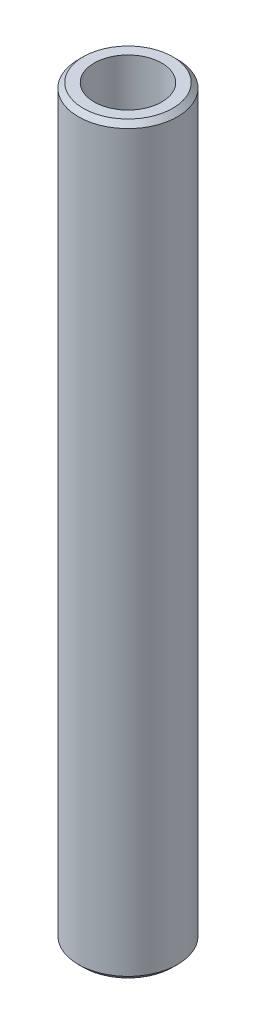
from build123d import *

# Parameters (mm, degrees)
SKETCH1_R           = 40
BOSS_EXTRUDE1_DEPTH = 600
SKETCH2_R           = 27.250790267
CUT_EXTRUDE1_DEPTH  = 603.660766933
CHAMFER1_SIZE       = 3.919962224


with BuildPart() as part:
    # Sketch1 → Boss-Extrude1 (new body)
    with BuildSketch(Plane(origin=(0, 0, 0), x_dir=(1, 0, 0), z_dir=(0, 1, 0))):
        Circle(SKETCH1_R)
    extrude(amount=BOSS_EXTRUDE1_DEPTH)

    # Sketch2 → Cut-Extrude1 (cut, through all)
    with BuildSketch(Plane(origin=(0, 0, 0), x_dir=(1, 0, 0), z_dir=(0, 1, 0))):
        Circle(SKETCH2_R)
    extrude(amount=CUT_EXTRUDE1_DEPTH, mode=Mode.SUBTRACT)

    # Chamfer1
    chamfer1_edges = [part.edges().sort_by_distance(p)[0] for p in [
        (-40, 600, 0),
        (-40, 0, 0),
    ]]
    chamfer(chamfer1_edges, length=CHAMFER1_SIZE)


solid = part.part
